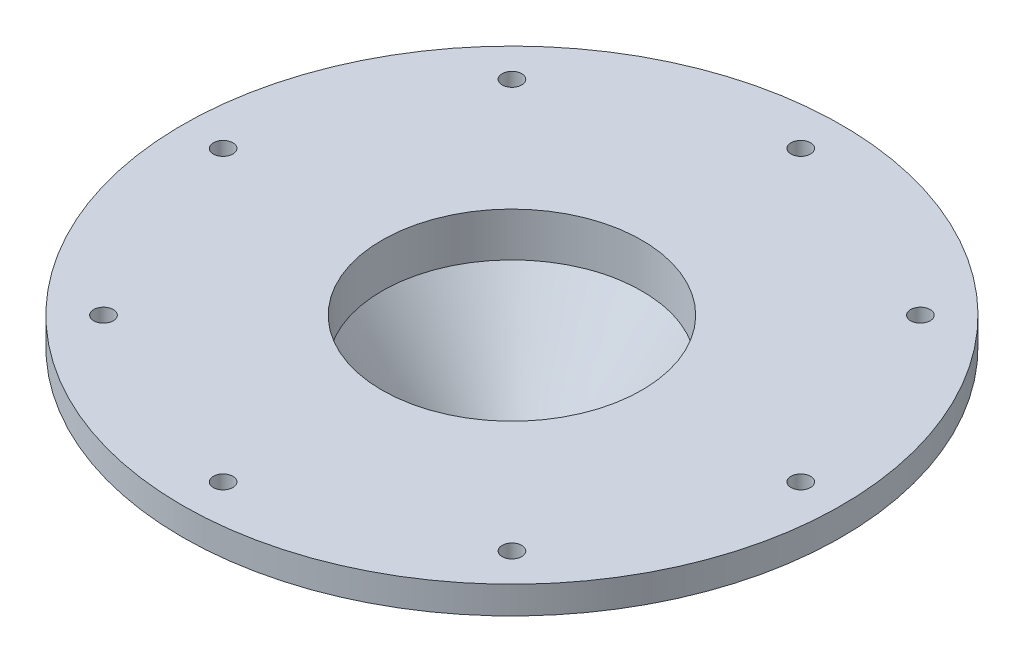
from build123d import *

# Parameters (mm, degrees)
SKETCH1_R                 = 38.04031
BOSS_EXTRUDE1_DEPTH       = 3.175
TAP_DRILL_FOR_4_40_TAP1_D = 2.2606
CIRPATTERN1_COUNT         = 8
SKETCH5_R                 = 25.4
BOSS_EXTRUDE2_DEPTH       = 19.05
CUT_EXTRUDE1_DEPTH        = 59.207224593
CUT_EXTRUDE1_DEPTH_BACK   = 59.207224593
SKETCH6_R                 = 5
SKETCH7_R                 = 15
CUT_EXTRUDE2_DEPTH        = 5.08


with BuildPart() as part:
    # Sketch1 → Boss-Extrude1 (new body)
    with BuildSketch(Plane(origin=(0, 0, 0), x_dir=(1, 0, 0), z_dir=(0, 1, 0))):
        with Locations(Location((0, 0, 0), (0, 0, 270))):
            Circle(SKETCH1_R)
    extrude(amount=BOSS_EXTRUDE1_DEPTH)

    # Tap Drill for #4-40 Tap1 (through all)
    with Locations(Plane(origin=(0, 0, 0), x_dir=(-1, 0, 0), z_dir=(0, -1, 0))):
        with Locations((0, -33.3375)):
            tap_drill_for_4_40_tap1 = Hole(TAP_DRILL_FOR_4_40_TAP1_D / 2)

    # CirPattern1: Tap Drill for #4-40 Tap1 ×8 about axis
    cirpattern1_axis = Axis((0, 0, 0), (0, 1, 0))
    for i in range(1, CIRPATTERN1_COUNT):
        add(tap_drill_for_4_40_tap1.rotate(cirpattern1_axis, i * 360 / CIRPATTERN1_COUNT), mode=Mode.SUBTRACT)

    # Sketch5 → Boss-Extrude2 (add)
    with BuildSketch(Plane.XZ):
        with Locations(Location((0, 0, 0), (0, 0, 90))):
            Circle(SKETCH5_R)
    extrude(amount=BOSS_EXTRUDE2_DEPTH)

    # Sketch6 → Cut-Extrude1 (cut, two sides: drawn at the far end of the back side and taken through both)
    with BuildSketch(Plane.XZ.offset(19.05).offset(-CUT_EXTRUDE1_DEPTH_BACK)):
        with Locations(Location((0, 0, 0), (0, 0, 270))):
            Circle(SKETCH6_R)
    extrude(amount=CUT_EXTRUDE1_DEPTH + CUT_EXTRUDE1_DEPTH_BACK, mode=Mode.SUBTRACT)

    # Sketch7 → Cut-Extrude2 (cut)
    with BuildSketch(Plane(origin=(0, 3.175, 0), x_dir=(1, 0, 0), z_dir=(0, 1, 0))):
        with Locations(Location((0, 0, 0), (0, 0, 270))):
            Circle(SKETCH7_R)
    extrude(amount=-CUT_EXTRUDE2_DEPTH, mode=Mode.SUBTRACT)

    # Cut-Loft1: read off the stored shape, not the designer's step
    # Cut-Loft1: loft between two sections, ruled curve by curve
    cut_loft1_from = [
        Edge.make_bspline([(0, -1.905, 15), (-30, -1.905, 15), (-30, -1.905, -15), (0, -1.905, -15), (30, -1.905, -15), (30, -1.905, 15), (0, -1.905, 15)], [0, 0, 0, 0, 0.5, 0.5, 0.5, 1, 1, 1, 1], 3, [1, 0.333333333, 0.333333333, 1, 0.333333333, 0.333333333, 1]),
    ]
    cut_loft1_to = [
        Edge.make_bspline([(-1.365853626, -15.875, 4.809827842), (-10.985509311, -15.875, 2.07812059), (-8.253802058, -15.875, -7.541535095), (1.365853626, -15.875, -4.809827842), (10.985509311, -15.875, -2.07812059), (8.253802058, -15.875, 7.541535095), (-1.365853626, -15.875, 4.809827842)], [0, 0, 0, 0, 0.5, 0.5, 0.5, 1, 1, 1, 1], 3, [1, 0.333333333, 0.333333333, 1, 0.333333333, 0.333333333, 1]),
    ]
    cut_loft1 = Solid(Shell([*[Face.make_surface_from_curves(cut_loft1_from[k], cut_loft1_to[k]) for k in range(1)], Face(Wire(cut_loft1_from)), Face(Wire(cut_loft1_to))]))
    add(cut_loft1, mode=Mode.SUBTRACT)

    # Sketch10 → Cut-Revolve1 (revolve, cut)
    with BuildSketch(Plane.XY):
        Polygon((-25.4, 0), (-24.4, 0), (-8.415152026, -19.05), (-25.4, -19.05), align=None)
    revolve(axis=Axis((0, 0, 0), (0, -1, 0)), mode=Mode.SUBTRACT)


solid = part.part
